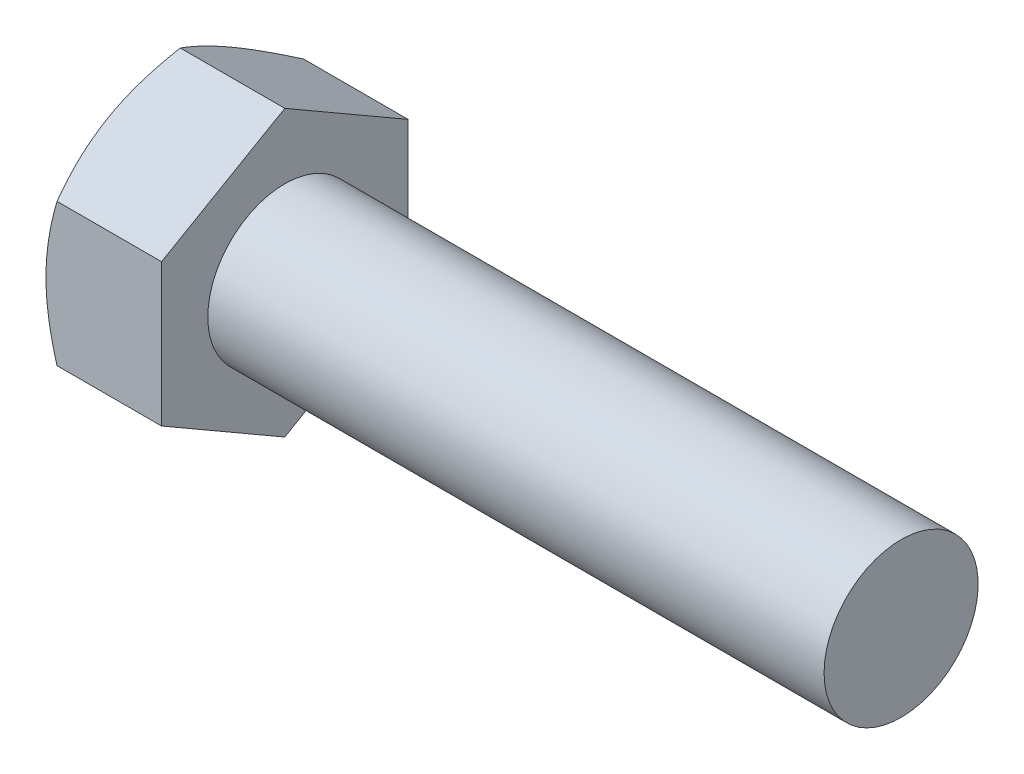
from build123d import *

# Parameters (mm, degrees)
SKETCH2_R        = 9.330254042
HEX_DIE_DEPTH    = 7.5
INDENT_OUTLINE_R = 7
INDENT_DEPTH     = 0.9375


# Read off the part's stored shape, not the designer's step: Indent
with BuildPart() as part:
    # BodySke → Base-Revolve (revolve)
    with BuildSketch(Plane.XY, mode=Mode.PRIVATE) as base_revolve_sk:
        Polygon((7.5, 5), (7.5, 9.237875289), (0.714687631, 9.237875289), (0, 8), (0, 0), (47.5, 0), (47.5, 5), align=None)
    revolve(base_revolve_sk.sketch.rotate(Axis((-25.4, 0, 0), (1, 0, 0)), 90), axis=Axis((-25.4, 0, 0), (1, 0, 0)))

    # Sketch2 → Hex-Die (cut)
    with BuildSketch(Plane(origin=(0, 0, 0), x_dir=(0, 0, -1), z_dir=(1, 0, 0))):
        Circle(SKETCH2_R)
        Polygon((-8, 4.618802174), (0, 9.237604347), (8, 4.618802174), (8, -4.618802174), (0, -9.237604347), (-8, -4.618802174), align=None, mode=Mode.SUBTRACT)
    extrude(amount=HEX_DIE_DEPTH, mode=Mode.SUBTRACT)

    # Indent outline → Indent (cut)
    with BuildSketch(Plane(origin=(0, 0, 0), x_dir=(0, 0, -1), z_dir=(1, 0, 0))):
        Circle(INDENT_OUTLINE_R)
    extrude(amount=INDENT_DEPTH, mode=Mode.SUBTRACT)


solid = part.part
